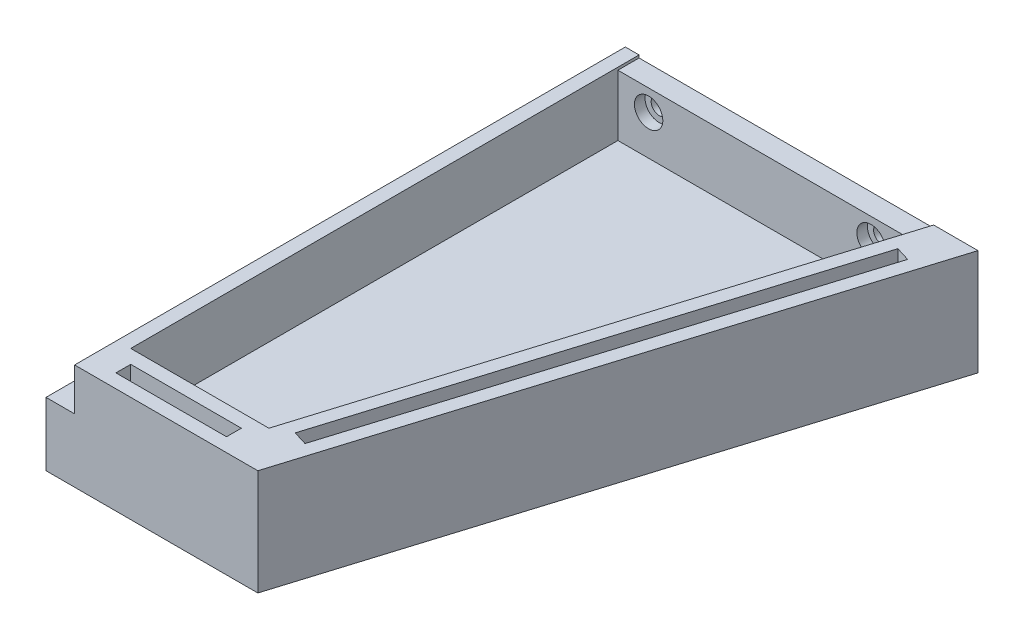
from build123d import *

# Parameters (mm, degrees)
BOSS_EXTRUDE1_DEPTH = 25
BOSS_EXTRUDE2_DEPTH = 10
SKETCH4_W           = 26.114253455
SKETCH4_H           = 3.5
CUT_EXTRUDE1_DEPTH  = 10
CUT_EXTRUDE2_DEPTH  = 0.625
CUT_EXTRUDE3_REACH  = 150.701
SKETCH6_R           = 1.9
SKETCH7_R           = 3.35
CUT_EXTRUDE4_DEPTH  = 2.5
LPATTERN1_COUNT     = 2
LPATTERN1_PITCH     = 52.5
SKETCH8_W           = 6.75
SKETCH8_H           = 130
CUT_EXTRUDE5_DEPTH  = 10


with BuildPart() as part:
    # Sketch1 → Boss-Extrude1 (new body)
    with BuildSketch(Plane(origin=(0, 0, 0), x_dir=(-1, 0, 0), z_dir=(0, 1, 0))):
        Polygon((26.563657866, 147.59508075), (-13.436342134, 17.59508075), (76.563657866, 17.59508075), (76.563657866, 147.59508075), align=None)
        Polygon((-1.435210974, 22.59508075), (33.949404411, 137.59508075), (66.563657866, 137.59508075), (66.563657866, 22.59508075), align=None, mode=Mode.SUBTRACT)
    extrude(amount=BOSS_EXTRUDE1_DEPTH)

    # Sketch3 → Boss-Extrude2 (add)
    with BuildSketch(Plane.XZ):
        Polygon((-76.563657866, 147.59508075), (-26.563657866, 147.59508075), (13.436342134, 17.59508075), (-76.563657866, 17.59508075), align=None)
    extrude(amount=-BOSS_EXTRUDE2_DEPTH)

    # Sketch4 → Cut-Extrude1 (cut)
    with BuildSketch(Plane(origin=(0, 25, 0), x_dir=(-1, 0, 0), z_dir=(0, 1, 0))):
        with Locations((50.256531139, 142.59508075)):
            Rectangle(SKETCH4_W, SKETCH4_H)
        Polygon((-3.585713743, 26.657141537), (29.887343624, 135.44457798), (26.542117093, 136.473878451), (-6.930940274, 27.686442008), align=None)
    extrude(amount=-CUT_EXTRUDE1_DEPTH, mode=Mode.SUBTRACT)

    # Sketch5 → Cut-Extrude2 (cut)
    with BuildSketch(Plane(origin=(0, 25, -3.02991925), x_dir=(1, 0, 0), z_dir=(0, -1, 0))):
        Polygon((1.435210974, 25.625), (-66.563657866, 25.625), (-66.563657866, 20.625), (2.973672512, 20.625), align=None)
    extrude(amount=CUT_EXTRUDE2_DEPTH, mode=Mode.SUBTRACT)

    # Sketch6 → Cut-Extrude3 (cut, up to next)
    with BuildSketch(Plane.XY.offset(22.59508075), mode=Mode.PRIVATE) as cut_extrude3_sk1:
        with Locations((-59.313657866, 19.375)):
            Circle(SKETCH6_R)
    cut_extrude3_tool1 = extrude(cut_extrude3_sk1.sketch, amount=-CUT_EXTRUDE3_REACH, mode=Mode.PRIVATE) & part.part
    cut_extrude3 = cut_extrude3_tool1.solids().sort_by_distance((-59.313658, 19.375, 22.595081))[0]
    add(cut_extrude3, mode=Mode.SUBTRACT)

    # Sketch7 → Cut-Extrude4 (cut)
    with BuildSketch(Plane.XY.offset(22.59508075)):
        with Locations((-59.313657866, 19.375)):
            Circle(SKETCH7_R)
    cut_extrude4 = extrude(amount=-CUT_EXTRUDE4_DEPTH, mode=Mode.SUBTRACT)

    # LPattern1: Cut-Extrude3, Cut-Extrude4 ×2
    with Locations(*[(i * LPATTERN1_PITCH, 0, 0) for i in range(1, LPATTERN1_COUNT)]):
        add(cut_extrude3, mode=Mode.SUBTRACT)
        add(cut_extrude4, mode=Mode.SUBTRACT)

    # Sketch8 → Cut-Extrude5 (cut)
    with BuildSketch(Plane(origin=(0, 25, 0), x_dir=(-1, 0, 0), z_dir=(0, 1, 0))):
        with Locations((73.188657866, 82.59508075)):
            Rectangle(SKETCH8_W, SKETCH8_H)
    extrude(amount=-CUT_EXTRUDE5_DEPTH, mode=Mode.SUBTRACT)


solid = part.part
